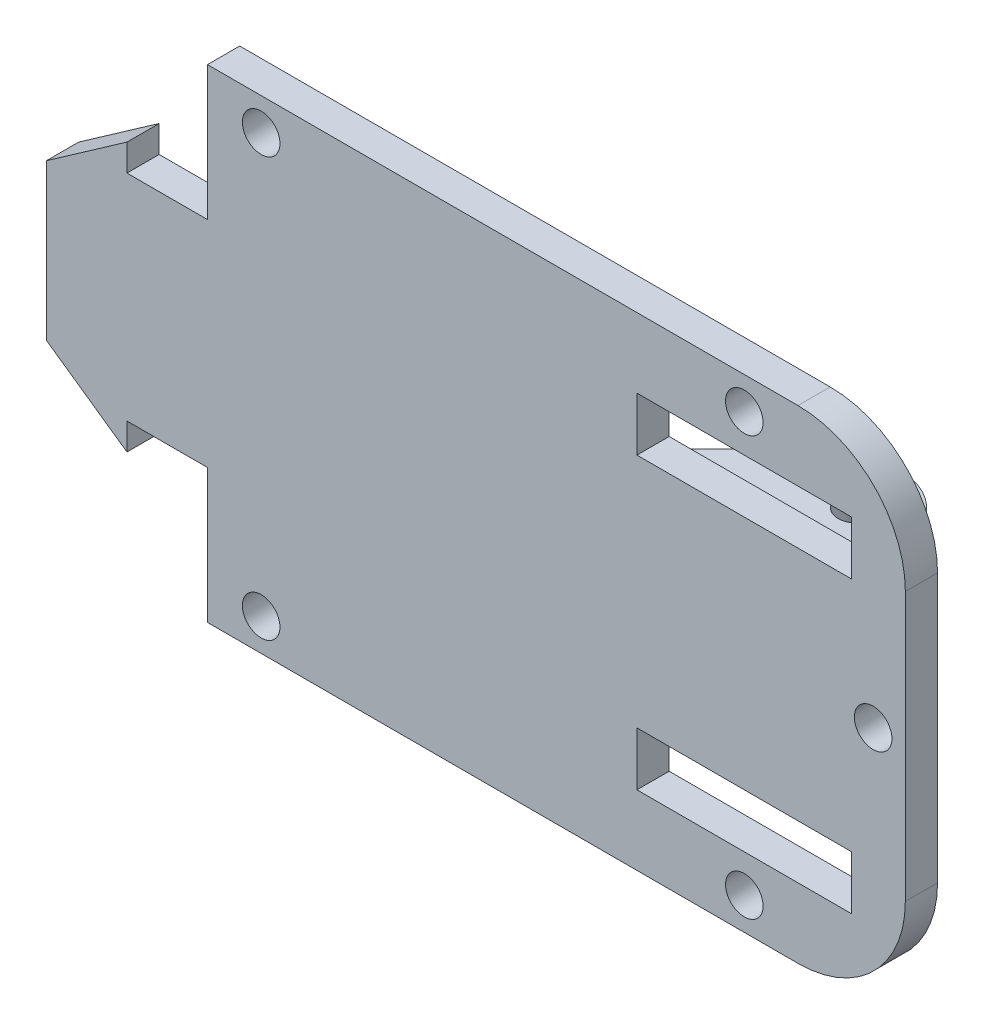
from build123d import *

# Parameters (mm, degrees)
SKETCH1_W           = 65
SKETCH1_H           = 45
BOSS_EXTRUDE1_DEPTH = 3
SKETCH2_W           = 10
SKETCH2_H           = 13
BOSS_EXTRUDE2_DEPTH = 12.5
SKETCH3_R           = 1.75
CUT_EXTRUDE1_DEPTH  = 13.5
FILLET1_R           = 6
CHAMFER1_SIZE       = 12
FILLET3_R           = 1
SKETCH4_W           = 20
SKETCH4_H           = 5
CUT_EXTRUDE3_DEPTH  = 5
FILLET4_R           = 10
CHAMFER2_SIZE       = 2.5
SKETCH7_R           = 1.75
CUT_EXTRUDE4_DEPTH  = 5
BOSS_EXTRUDE4_DEPTH = 3


with BuildPart() as part:
    # Sketch1 → Boss-Extrude1 (new body)
    with BuildSketch(Plane.XY):
        with Locations((-11.936997319, -3.156836461)):
            Rectangle(SKETCH1_W, SKETCH1_H)
    extrude(amount=BOSS_EXTRUDE1_DEPTH)

    # Sketch2 → Boss-Extrude2 (add)
    with BuildSketch(Plane(origin=(0, 0, 0), x_dir=(-1, 0, 0), z_dir=(0, 0, -1))):
        with Locations((-5.563002681, -3.156836461)):
            Rectangle(SKETCH2_W, SKETCH2_H)
    extrude(amount=BOSS_EXTRUDE2_DEPTH)

    # Sketch3 → Cut-Extrude1 (cut)
    with BuildSketch(Plane(origin=(0, 3.343163539, 0), x_dir=(1, 0, 0), z_dir=(0, 1, 0))):
        with Locations(Location((5.563002681, 7.5, 0), (0, 0, 180))):
            Circle(SKETCH3_R)
    extrude(amount=-CUT_EXTRUDE1_DEPTH, mode=Mode.SUBTRACT)

    # Fillet1
    fillet1_edges = [part.edges().sort_by_distance(p)[0] for p in [
        (10.563002681, -3.156836461, -12.5),
    ]]
    fillet(fillet1_edges, radius=FILLET1_R)

    # Chamfer1
    chamfer1_edges = [part.edges().sort_by_distance(p)[0] for p in [
        (0.563002681, -3.156836461, 0),
    ]]
    chamfer(chamfer1_edges, length=CHAMFER1_SIZE)

    # Fillet3
    # the kernel refuses this fillet: 1 mm, written as the material it takes off along each edge
    with BuildSketch(Plane(origin=(0.563002681, 5.508227048, -12.5), x_dir=(1, 0, 0), z_dir=(0, -1, 0))) as fillet3_piece_1:
        with BuildLine():
            CenterArc((0.866025404, 1), FILLET3_R, 210, 60)
            Line((0, 0.5), (-0.017320508, 0.49))
            ThreePointArc((-0.017320508, 0.49), (-0.02, 0.25), (-0.02, 0))
            Line((-0.02, 0), (0, -0.02))
            Line((0, -0.02), (0.866025404, -0.02))
            Line((0.866025404, -0.02), (0.866025404, 0))
        make_face()
    extrude(amount=17.330127019, mode=Mode.SUBTRACT)

    # Sketch4 → Cut-Extrude3 (cut)
    with BuildSketch(Plane(origin=(0, 0, 0), x_dir=(-1, 0, 0), z_dir=(0, 0, -1))):
        with Locations((-5.563002681, 10.343163539)):
            Rectangle(SKETCH4_W, SKETCH4_H)
    cut_extrude3 = extrude(amount=-CUT_EXTRUDE3_DEPTH, mode=Mode.SUBTRACT)

    # Mirror2: Cut-Extrude3 across plane
    add(cut_extrude3.mirror(Plane.ZX.offset(-3.156836461)), mode=Mode.SUBTRACT)

    # Fillet4
    fillet4_edges = [part.edges().sort_by_distance(p)[0] for p in [
        (20.563002681, 19.343163539, 1.5),
        (20.563002681, -25.656836461, 1.5),
    ]]
    fillet(fillet4_edges, radius=FILLET4_R)

    # Chamfer2
    chamfer2_edges = [part.edges().sort_by_distance(p)[0] for p in [
        (10.563002681, -3.156836461, 0),
    ]]
    chamfer(chamfer2_edges, length=CHAMFER2_SIZE)

    # Sketch7 → Cut-Extrude4 (cut)
    with BuildSketch(Plane(origin=(0, 0, 0), x_dir=(-1, 0, 0), z_dir=(0, 0, -1))):
        with Locations((-17.563002681, -3.156836461)):
            Circle(SKETCH7_R)
        with Locations((-5.563002681, 16.343163539)):
            Circle(SKETCH7_R)
        with Locations((39.436997319, 16.343163539)):
            Circle(SKETCH7_R)
        with Locations(Location((39.436997319, -22.656836461, 0), (0, 0, 180))):
            Circle(SKETCH7_R)
        with Locations(Location((-5.563002681, -22.656836461, 0), (0, 0, 180))):
            Circle(SKETCH7_R)
    extrude(amount=-CUT_EXTRUDE4_DEPTH, mode=Mode.SUBTRACT)

    # Sketch8 → Boss-Extrude4 (add)
    with BuildSketch(Plane(origin=(0, 0, 0), x_dir=(-1, 0, 0), z_dir=(0, 0, -1))):
        Polygon((44.436997319, 6.843163539), (51.936997319, 6.843163539), (51.936997319, 9.343163539), (59.436997319, 4.091607002), (59.436997319, -10.405279925), (51.936997319, -15.656836461), (51.936997319, -13.156836461), (44.436997319, -13.156836461), align=None)
    extrude(amount=-BOSS_EXTRUDE4_DEPTH)


solid = part.part
